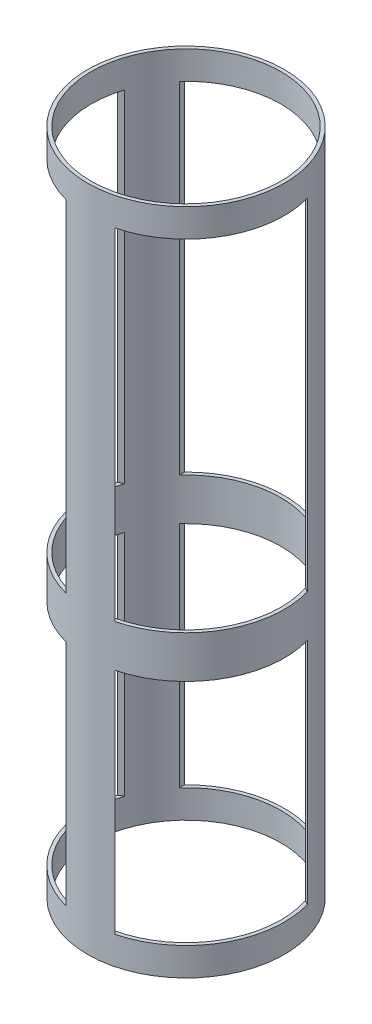
from build123d import *

# Parameters (mm, degrees)
SKETCH1_R               = 88.9
SKETCH1_R_2             = 85.725
BOSS_EXTRUDE1_DEPTH     = 301.625
CUT_EXTRUDE1_REACH      = 328.778
CUT_EXTRUDE1_END_RADIUS = 88.9
SKETCH2_W               = 127
SKETCH2_H               = 206.502
SKETCH2_H_2             = 307.848
CIRPATTERN1_COUNT       = 3


with BuildPart() as part:
    # Sketch1 → Boss-Extrude1 (new, symmetric)
    with BuildSketch(Plane(origin=(0, 0, 0), x_dir=(1, 0, 0), z_dir=(0, 1, 0))):
        Circle(SKETCH1_R)
        Circle(SKETCH1_R_2, mode=Mode.SUBTRACT)
    extrude(amount=BOSS_EXTRUDE1_DEPTH, both=True)

    # Cut-Extrude1: up to this cylinder (the profile starts inside it)
    cut_extrude1_end = Plane(origin=(0, -25.3365, 0), z_dir=(0, -1, 0)) * Cylinder(CUT_EXTRUDE1_END_RADIUS, 1131.631, mode=Mode.PRIVATE)
    # Sketch2 → Cut-Extrude1 (cut, up to the surface)
    with BuildSketch(Plane.XY, mode=Mode.PRIVATE) as cut_extrude1_sk1:
        with Locations((0, -172.974)):
            Rectangle(SKETCH2_W, SKETCH2_H)
    cut_extrude1_tool1 = extrude(cut_extrude1_sk1.sketch, amount=-CUT_EXTRUDE1_REACH, mode=Mode.PRIVATE) & cut_extrude1_end
    # Sketch2 → Cut-Extrude1 (cut, up to the surface)
    with BuildSketch(Plane.XY, mode=Mode.PRIVATE) as cut_extrude1_sk2:
        with Locations((0, 122.301)):
            Rectangle(SKETCH2_W, SKETCH2_H_2)
    cut_extrude1_tool2 = extrude(cut_extrude1_sk2.sketch, amount=-CUT_EXTRUDE1_REACH, mode=Mode.PRIVATE) & cut_extrude1_end
    cut_extrude1 = cut_extrude1_tool1.solids().sort_by_distance((0, -172.974, 0))[0] + cut_extrude1_tool2.solids().sort_by_distance((0, 122.301, 0))[0]
    add(cut_extrude1, mode=Mode.SUBTRACT)

    # CirPattern1: Cut-Extrude1 ×3 about axis
    cirpattern1_axis = Axis((0, 301.625, 0), (0, -1, 0))
    for i in range(1, CIRPATTERN1_COUNT):
        add(cut_extrude1.rotate(cirpattern1_axis, i * 360 / CIRPATTERN1_COUNT), mode=Mode.SUBTRACT)


solid = part.part
